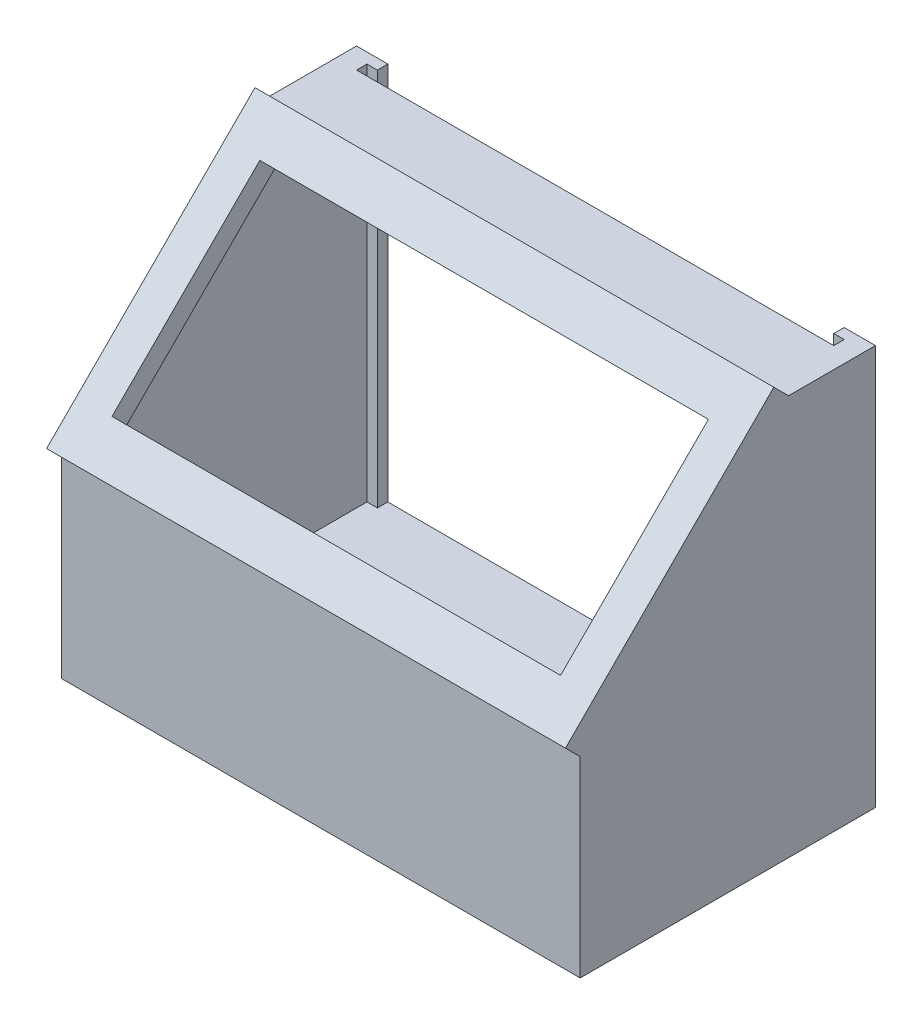
from build123d import *

# Parameters (mm, degrees)
SKETCH1_W           = 249.00380235
SKETCH1_H           = 131.677440474
BOSS_EXTRUDE1_DEPTH = 192
CHAMFER1_SIZE       = 100
SKETCH2_W           = 249.00380235
SKETCH2_H           = 141.421356237
SKETCH2_W_2         = 215.26057226
SKETCH2_H_2         = 100.329330499
BOSS_EXTRUDE2_DEPTH = 10
SHELL1_START        = -114.501901175
SHELL1_DEPTH        = 229.00380235
BOSS_EXTRUDE3_DEPTH = 5
SKETCH4_W           = 5
SKETCH4_H           = 182
BOSS_EXTRUDE4_DEPTH = 5


# Read off the part's stored shape, not the designer's step: Shell1
with BuildPart() as part:
    # Sketch1 → Boss-Extrude1 (new body)
    with BuildSketch(Plane(origin=(0, 0, 0), x_dir=(1, 0, 0), z_dir=(0, 1, 0))):
        Rectangle(SKETCH1_W, SKETCH1_H)
    extrude(amount=BOSS_EXTRUDE1_DEPTH)

    # Chamfer1
    chamfer1_edges = [part.edges().sort_by_distance(p)[0] for p in [
        (0, 192, 65.838720237),
    ]]
    chamfer(chamfer1_edges, length=CHAMFER1_SIZE)

    # Sketch2 → Boss-Extrude2 (add)
    with BuildSketch(Plane(origin=(0, 78.919360119, 78.919360119), x_dir=(1, 0, 0), z_dir=(0, 0.7071067811865464, 0.7071067811865487))):
        with Locations((0, 89.209496444)):
            Rectangle(SKETCH2_W, SKETCH2_H)
        with Locations((0, 89.209496444)):
            Rectangle(SKETCH2_W_2, SKETCH2_H_2, mode=Mode.SUBTRACT)
    extrude(amount=BOSS_EXTRUDE2_DEPTH)

    # Shell1 outline → Shell1 (cut)
    with BuildSketch(Plane.YZ.offset(SHELL1_START)):
        Polygon((96.142135624, 55.838720237), (10, 55.838720237), (10, -65.838720237), (182, -65.838720237), (182, -30.019144139), (184.928932188, -27.090211951), (99.071067812, 58.767652425), align=None)
    extrude(amount=SHELL1_DEPTH, mode=Mode.SUBTRACT)

    # Sketch3 → Boss-Extrude3 (add)
    with BuildSketch(Plane(origin=(0, 0, -65.838720237), x_dir=(-1, 0, 0), z_dir=(0, 0, -1))):
        Polygon((-114.501901175, 10), (-114.501901175, 182), (-114.501901175, 192), (-124.501901175, 192), (-124.501901175, 0), (124.501901175, 0), (124.501901175, 192), (114.501901175, 192), (114.501901175, 182), (114.501901175, 10), align=None)
    extrude(amount=BOSS_EXTRUDE3_DEPTH)

    # Sketch4 → Boss-Extrude4 (add)
    with BuildSketch(Plane(origin=(0, 0, -70.838720237), x_dir=(-1, 0, 0), z_dir=(0, 0, -1))):
        Polygon((124.501901175, 192), (114.501901175, 192), (114.501901175, 10), (-114.501901175, 10), (-114.501901175, 192), (-124.501901175, 192), (-124.501901175, 0), (124.501901175, 0), align=None)
        with Locations((112.001901175, 101)):
            Rectangle(SKETCH4_W, SKETCH4_H)
        with Locations((-112.001901175, 101)):
            Rectangle(SKETCH4_W, SKETCH4_H)
    extrude(amount=BOSS_EXTRUDE4_DEPTH)


solid = part.part
